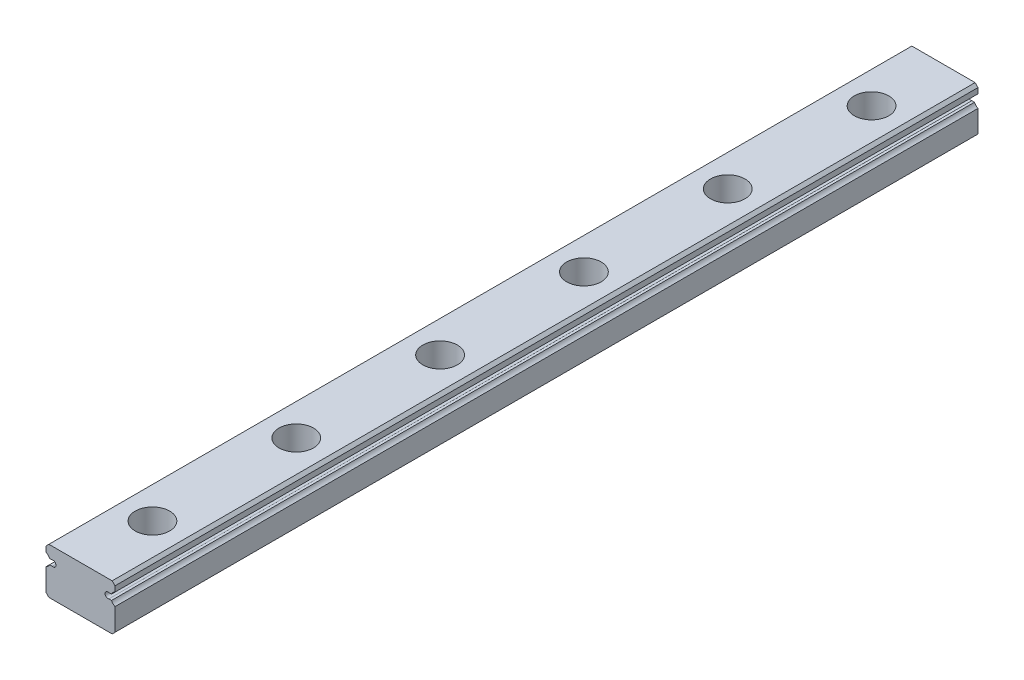
from build123d import *

# Parameters (mm, degrees)
BOSS_EXTRUDE1_DEPTH = 150
SKETCH2_R           = 3
CUT_EXTRUDE1_DEPTH  = 4.5
SKETCH3_R           = 1.75
CUT_EXTRUDE2_DEPTH  = 151.187382959
LPATTERN1_COUNT     = 6
LPATTERN1_PITCH     = 25


with BuildPart() as part:
    # Sketch1 → Boss-Extrude1 (new body)
    with BuildSketch(Plane.XY):
        with BuildLine():
            Line((-5.5, -4), (5.5, -4))
            Line((5.5, -4), (6, -3.5))
            Line((6, -3.5), (6, 0.368911094))
            ThreePointArc((6, 0.368911094), (5.63354293, 0.61854293), (5.383911094, 0.985))
            Line((5.383911094, 0.985), (4.92112495, 0.985))
            ThreePointArc((4.92112495, 0.985), (4.265, 1.46), (4.92112495, 1.935))
            Line((4.92112495, 1.935), (5.383911094, 1.935))
            ThreePointArc((5.383911094, 1.935), (5.63354293, 2.30145707), (6, 2.551088906))
            Line((6, 2.551088906), (6, 3.5))
            Line((6, 3.5), (5.5, 4))
            Line((5.5, 4), (-5.5, 4))
            Line((-5.5, 4), (-6, 3.5))
            Line((-6, 3.5), (-6, 2.551088906))
            ThreePointArc((-6, 2.551088906), (-5.63354293, 2.30145707), (-5.383911094, 1.935))
            Line((-5.383911094, 1.935), (-4.92112495, 1.935))
            ThreePointArc((-4.92112495, 1.935), (-4.265, 1.46), (-4.92112495, 0.985))
            Line((-4.92112495, 0.985), (-5.383911094, 0.985))
            ThreePointArc((-5.383911094, 0.985), (-5.63354293, 0.61854293), (-6, 0.368911094))
            Line((-6, 0.368911094), (-6, -3.5))
            Line((-6, -3.5), (-5.5, -4))
        make_face()
    extrude(amount=BOSS_EXTRUDE1_DEPTH)

    # Sketch2 → Cut-Extrude1 (cut)
    with BuildSketch(Plane(origin=(0, 4, 0), x_dir=(1, 0, 0), z_dir=(0, 1, 0))):
        with Locations((0, -12.5)):
            Circle(SKETCH2_R)
    cut_extrude1 = extrude(amount=-CUT_EXTRUDE1_DEPTH, mode=Mode.SUBTRACT)

    # Sketch3 → Cut-Extrude2 (cut, through all)
    with BuildSketch(Plane(origin=(0, -0.5, 0), x_dir=(1, 0, 0), z_dir=(0, 1, 0))):
        with Locations((0, -12.5)):
            Circle(SKETCH3_R)
    cut_extrude2 = extrude(amount=-CUT_EXTRUDE2_DEPTH, mode=Mode.SUBTRACT)

    # LPattern1: Cut-Extrude1, Cut-Extrude2 ×6
    with Locations(*[(0, 0, i * LPATTERN1_PITCH) for i in range(1, LPATTERN1_COUNT)]):
        add(cut_extrude1, mode=Mode.SUBTRACT)
        add(cut_extrude2, mode=Mode.SUBTRACT)


solid = part.part
